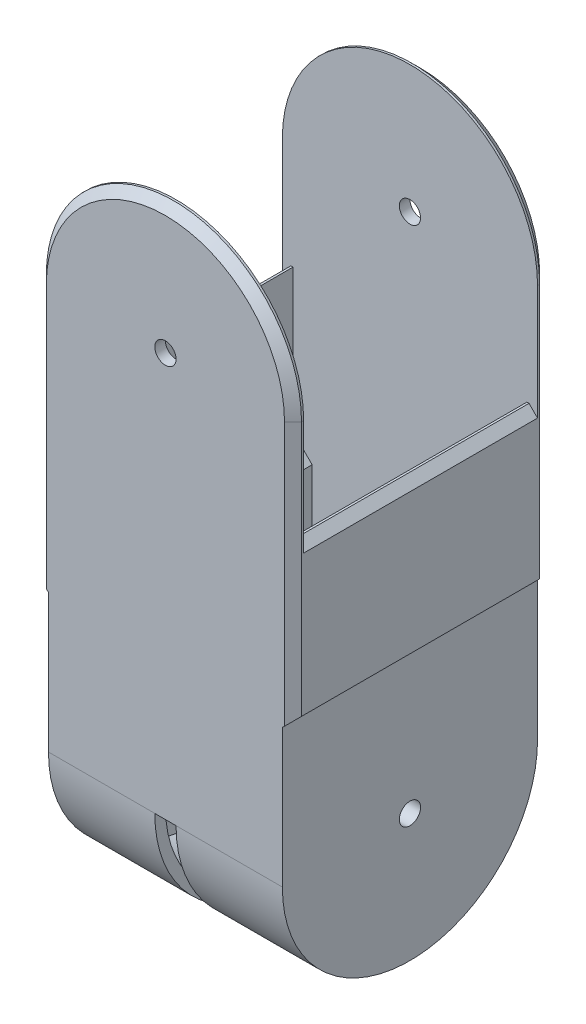
from build123d import *

# Parameters (mm, degrees)
SKETCH1_W               = 60
SKETCH1_H               = 60
BOSS_EXTRUDE1_DEPTH     = 100
SKETCH4_R               = 2.5
BOSS_EXTRUDE2_DEPTH     = 2.5
CUT_EXTRUDE1_DEPTH      = 169.893457541
CUT_EXTRUDE1_DEPTH_BACK = 169.893457541
SKETCH5_R               = 2.5
SKETCH6_W               = 60
SKETCH6_H               = 60
CUT_EXTRUDE2_DEPTH      = 2.5
CHAMFER1_SIZE           = 2
CHAMFER2_SIZE           = 5
SKETCH7_W               = 55
SKETCH7_H               = 55
CUT_EXTRUDE3_DEPTH      = 35
SKETCH8_W               = 46
SKETCH8_H               = 55
CUT_EXTRUDE4_DEPTH      = 35
CUT_EXTRUDE5_DEPTH      = 46
SKETCH10_W              = 5
SKETCH10_H              = 60
CUT_EXTRUDE6_DEPTH      = 30
CHAMFER3_SIZE           = 3


with BuildPart() as part:
    # Sketch1 → Boss-Extrude1 (new body)
    with BuildSketch(Plane(origin=(0, 0, 0), x_dir=(1, 0, 0), z_dir=(0, 1, 0))):
        Rectangle(SKETCH1_W, SKETCH1_H)
    extrude(amount=BOSS_EXTRUDE1_DEPTH)

    # Sketch4 → Boss-Extrude2 (add)
    with BuildSketch(Plane(origin=(0, 0, -30), x_dir=(-1, 0, 0), z_dir=(0, 0, -1))):
        with BuildLine():
            Line((-30, 100), (30, 100))
            Line((30, 100), (30, 125))
            ThreePointArc((30, 125), (0, 155), (-30, 125))
            Line((-30, 125), (-30, 100))
        make_face()
        with Locations((0, 125)):
            Circle(SKETCH4_R, mode=Mode.SUBTRACT)
    boss_extrude2 = extrude(amount=-BOSS_EXTRUDE2_DEPTH)

    # Mirror2: Boss-Extrude2 across plane
    add(boss_extrude2.mirror(Plane.XY))

    # Sketch5 → Cut-Extrude1 (cut, two sides: drawn at the far end of the back side and taken through both)
    with BuildSketch(Plane.ZY.offset(-30).offset(-CUT_EXTRUDE1_DEPTH_BACK)):
        with BuildLine():
            Line((-30, 0), (2.9e-08, 0))
            ThreePointArc((2.9e-08, 0), (-21.213203425, 8.786796554), (-30, 30))
            Line((-30, 30), (-30, 0))
        make_face()
        with BuildLine():
            Line((30, 0), (30, 30))
            ThreePointArc((30, 30), (21.213203446, 8.786796575), (2.9e-08, 0))
            Line((2.9e-08, 0), (30, 0))
        make_face()
        with Locations((0, 30)):
            Circle(SKETCH5_R)
    extrude(amount=CUT_EXTRUDE1_DEPTH + CUT_EXTRUDE1_DEPTH_BACK, mode=Mode.SUBTRACT)

    # Sketch6 → Cut-Extrude2 (cut)
    with BuildSketch(Plane(origin=(30, 0, 0), x_dir=(0, 0, -1), z_dir=(1, 0, 0))):
        with Locations((0, 30)):
            Rectangle(SKETCH6_W, SKETCH6_H)
    cut_extrude2 = extrude(amount=-CUT_EXTRUDE2_DEPTH, mode=Mode.SUBTRACT)

    # Mirror3: Cut-Extrude2 across plane
    add(cut_extrude2.mirror(Plane(origin=(0, 0, 0), x_dir=(0, 0, 1), z_dir=(1, 0, 0))), mode=Mode.SUBTRACT)

    # Chamfer1
    chamfer1_edges = [part.edges().sort_by_distance(p)[0] for p in [
        (-30, 100, 0),
        (0, 155, -30),
        (30, 100, 0),
        (0, 155, 30),
        (30, 92.5, 30),
        (-30, 92.5, 30),
        (-30, 92.5, -30),
        (30, 92.5, -30),
    ]]
    chamfer(chamfer1_edges, length=CHAMFER1_SIZE)

    # Chamfer2
    # the kernel refuses this chamfer: 5 mm, written as the material it takes off along each edge
    with BuildSketch(Plane(origin=(30, 60, 40.85841494), x_dir=(0.027495876610586282, 0.9996219169112968, 0), z_dir=(0, 0, -1))) as chamfer2_piece_1_section:
        Polygon((CHAMFER2_SIZE * 0.999621916911, -CHAMFER2_SIZE * 0.0274958766106), (-CHAMFER2_SIZE * 0.0274958766106, -CHAMFER2_SIZE * 0.999621916911), (0, 0), align=None)
    chamfer2_piece_1 = extrude(amount=81.71682988, mode=Mode.PRIVATE)
    chamfer2_piece_1 = split(chamfer2_piece_1, bisect_by=Plane(origin=(27.5, 61.967005421, 0), z_dir=(1, 0, 0)), keep=Keep.TOP, mode=Mode.PRIVATE)
    add(chamfer2_piece_1, mode=Mode.SUBTRACT)
    with BuildSketch(Plane(origin=(-30, 60, 40.85841494), x_dir=(-0.027495876610586282, 0.9996219169112968, 0), z_dir=(0, 0, -1))) as chamfer2_piece_2_section:
        Polygon((CHAMFER2_SIZE * 0.999621916911, CHAMFER2_SIZE * 0.0274958766106), (-CHAMFER2_SIZE * 0.0274958766106, CHAMFER2_SIZE * 0.999621916911), (0, 0), align=None)
    chamfer2_piece_2 = extrude(amount=81.71682988, mode=Mode.PRIVATE)
    chamfer2_piece_2 = split(chamfer2_piece_2, bisect_by=Plane(origin=(-27.5, 61.967005421, 0), z_dir=(-1, 0, 0)), keep=Keep.TOP, mode=Mode.PRIVATE)
    add(chamfer2_piece_2, mode=Mode.SUBTRACT)

    # Sketch7 → Cut-Extrude3 (cut)
    with BuildSketch(Plane(origin=(0, 100, 0), x_dir=(1, 0, 0), z_dir=(0, 1, 0))):
        Rectangle(SKETCH7_W, SKETCH7_H)
    extrude(amount=-CUT_EXTRUDE3_DEPTH, mode=Mode.SUBTRACT)

    # Sketch8 → Cut-Extrude4 (cut)
    with BuildSketch(Plane(origin=(0, 65, 0), x_dir=(1, 0, 0), z_dir=(0, 1, 0))):
        Rectangle(SKETCH8_W, SKETCH8_H)
    extrude(amount=-CUT_EXTRUDE4_DEPTH, mode=Mode.SUBTRACT)

    # Sketch9 → Cut-Extrude5 (cut)
    with BuildSketch(Plane.ZY.offset(-23)):
        with BuildLine():
            Line((-27.5, 30), (27.5, 30))
            ThreePointArc((27.5, 30), (0, 2.5), (-27.5, 30))
        make_face()
    extrude(amount=CUT_EXTRUDE5_DEPTH, mode=Mode.SUBTRACT)

    # Sketch10 → Cut-Extrude6 (cut)
    with BuildSketch(Plane(origin=(0, 0, 0), x_dir=(1, 0, 0), z_dir=(0, 1, 0))):
        Rectangle(SKETCH10_W, SKETCH10_H)
    extrude(amount=CUT_EXTRUDE6_DEPTH, mode=Mode.SUBTRACT)

    # Chamfer3
    chamfer3_edges = [part.edges().sort_by_distance(p)[0] for p in [
        (23, 65, 0),
        (-23, 65, 0),
    ]]
    chamfer(chamfer3_edges, length=CHAMFER3_SIZE)


solid = part.part
